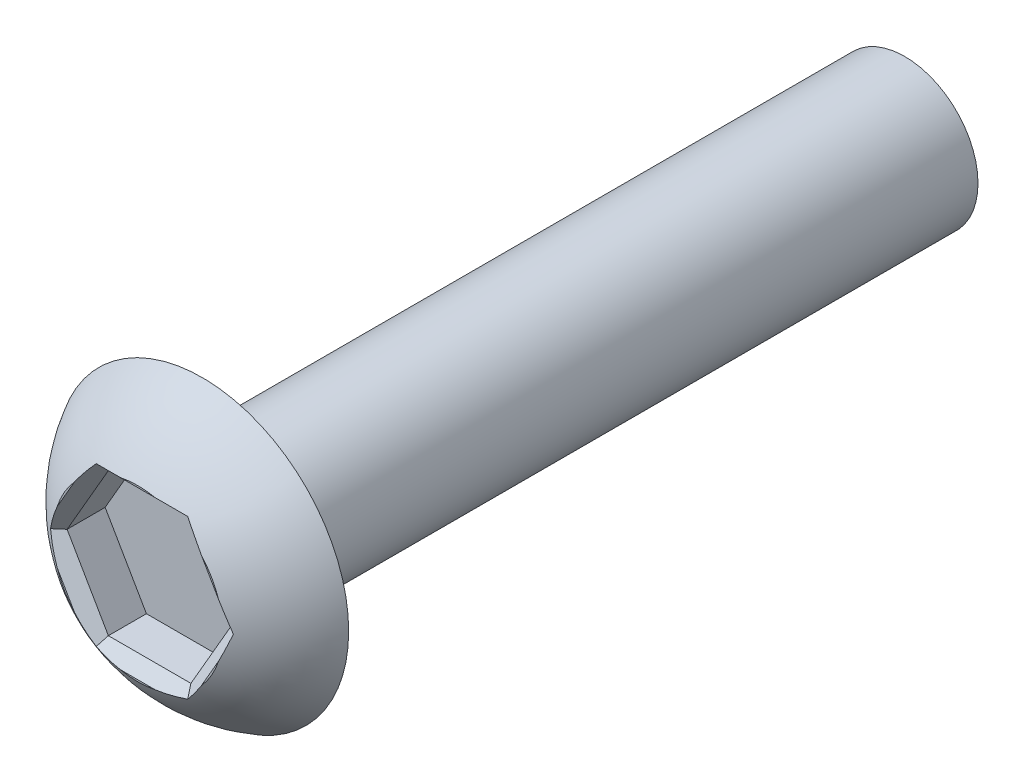
from build123d import *

# Parameters (mm, degrees)
SKETCH1_R               = 1.25
BOSS_EXTRUDE1_DEPTH     = 12
CUT_EXTRUDE1_DEPTH      = 1.25
CUT_EXTRUDE2_DEPTH      = 13.509996003
CUT_EXTRUDE2_DEPTH_BACK = 13.509996003
SKETCH6_W               = 1.249656436
SKETCH6_H               = 4.384153796
CHAMFER2_SIZE           = 0.2


with BuildPart() as part:
    # Sketch1 → Boss-Extrude1 (new body)
    with BuildSketch(Plane.XY):
        Circle(SKETCH1_R)
    extrude(amount=-BOSS_EXTRUDE1_DEPTH)

    # Sketch3 → Revolve1 (revolve)
    with BuildSketch(Plane(origin=(0, 0, 0), x_dir=(0, 0, -1), z_dir=(1, 0, 0)), mode=Mode.PRIVATE) as revolve1_sk:
        with BuildLine():
            ThreePointArc((-1.5, 0), (-1.096229956, 1.457737974), (0, 2.5))
            Line((0, 2.5), (0, 0))
            Line((0, 0), (-1.5, 0))
        make_face()
    revolve(revolve1_sk.sketch.rotate(Axis((0, 0, 1.5), (0, 0, -1)), 180), axis=Axis((0, 0, 1.5), (0, 0, -1)))

    # Sketch5 → Cut-Extrude1 (cut)
    with BuildSketch(Plane(origin=(0, 0, 1.5), x_dir=(-1, 0, 0), z_dir=(0, 0, -1))):
        Polygon((-1.409901945, 0), (-0.704950973, -1.221010901), (0.704950973, -1.221010901), (1.409901945, 0), (0.704950973, 1.221010901), (-0.704950973, 1.221010901), align=None)
    extrude(amount=CUT_EXTRUDE1_DEPTH, mode=Mode.SUBTRACT)

    # Sketch6 → Cut-Extrude2 (cut, two sides: drawn at the far end of the back side and taken through both)
    with BuildSketch(Plane(origin=(0, 0, 0), x_dir=(0, 0, -1), z_dir=(1, 0, 0)).offset(-CUT_EXTRUDE2_DEPTH_BACK)):
        with Locations((-1.724828218, 0.205450463)):
            Rectangle(SKETCH6_W, SKETCH6_H)
    extrude(amount=CUT_EXTRUDE2_DEPTH + CUT_EXTRUDE2_DEPTH_BACK, mode=Mode.SUBTRACT)

    # Chamfer2
    # the kernel refuses this chamfer: 0.2 mm, written as the material it takes off along each edge
    with BuildSketch(Plane(origin=(1.21928757, 1.221010901, 1.1), x_dir=(1.0390370186618431e-14, 0.9996219169112966, 0.02749587661058733), z_dir=(-1, 0, 0))) as chamfer2_piece_1_section:
        Polygon((CHAMFER2_SIZE * 0.999621916911, CHAMFER2_SIZE * 0.0274958766106), (-CHAMFER2_SIZE * 0.0274958766106, CHAMFER2_SIZE * 0.999621916911), (0, 0), align=None)
    chamfer2_piece_1 = extrude(amount=2.43857514, mode=Mode.PRIVATE)
    chamfer2_piece_1 = split(chamfer2_piece_1, bisect_by=Plane(origin=(0.501104512, 1.574083329, 1.032865614), z_dir=(-0.8660254037844416, -0.49999999999999495, 0)), keep=Keep.TOP, mode=Mode.PRIVATE)
    chamfer2_piece_1 = split(chamfer2_piece_1, bisect_by=Plane(origin=(-0.501104512, 1.574083329, 1.032865614), z_dir=(0.8660254037844347, -0.500000000000007, 0)), keep=Keep.TOP, mode=Mode.PRIVATE)
    add(chamfer2_piece_1, mode=Mode.SUBTRACT)
    with BuildSketch(Plane(origin=(1.667070244, -0.44542856, 1.1), x_dir=(0.8656979742248833, 0.4998109584556433, 0.027495876610586282), z_dir=(-0.49999999999999495, 0.8660254037844416, 0))) as chamfer2_piece_2_section:
        Polygon((CHAMFER2_SIZE * 0.999621916911, CHAMFER2_SIZE * 0.0274958766106), (-CHAMFER2_SIZE * 0.0274958766106, CHAMFER2_SIZE * 0.999621916911), (0, 0), align=None)
    chamfer2_piece_2 = extrude(amount=2.43857514, mode=Mode.PRIVATE)
    chamfer2_piece_2 = split(chamfer2_piece_2, bisect_by=Plane(origin=(1.613748406, 0.353072427, 1.032865614), z_dir=(-0.8660254037844382, 0.500000000000001, 0)), keep=Keep.TOP, mode=Mode.PRIVATE)
    chamfer2_piece_2 = split(chamfer2_piece_2, bisect_by=Plane(origin=(1.112643894, 1.221010901, 1.032865614), z_dir=(0, -1, 0)), keep=Keep.TOP, mode=Mode.PRIVATE)
    add(chamfer2_piece_2, mode=Mode.SUBTRACT)
    with BuildSketch(Plane(origin=(0.447782674, -1.666439461, 1.1), x_dir=(0.8656979742248797, -0.4998109584556493, 0.02749587661058626), z_dir=(0.500000000000001, 0.8660254037844382, 0))) as chamfer2_piece_3_section:
        Polygon((CHAMFER2_SIZE * 0.999621916911, CHAMFER2_SIZE * 0.0274958766106), (-CHAMFER2_SIZE * 0.0274958766106, CHAMFER2_SIZE * 0.999621916911), (0, 0), align=None)
    chamfer2_piece_3 = extrude(amount=2.43857514, mode=Mode.PRIVATE)
    chamfer2_piece_3 = split(chamfer2_piece_3, bisect_by=Plane(origin=(1.112643894, -1.221010901, 1.032865614), z_dir=(0, 1, 0)), keep=Keep.TOP, mode=Mode.PRIVATE)
    chamfer2_piece_3 = split(chamfer2_piece_3, bisect_by=Plane(origin=(1.613748406, -0.353072427, 1.032865614), z_dir=(-0.8660254037844416, -0.49999999999999495, 0)), keep=Keep.TOP, mode=Mode.PRIVATE)
    add(chamfer2_piece_3, mode=Mode.SUBTRACT)
    with BuildSketch(Plane(origin=(-1.21928757, -1.221010901, 1.1), x_dir=(-3.30602687756041e-15, -0.9996219169112968, 0.027495876610586285), z_dir=(1, 0, 0))) as chamfer2_piece_4_section:
        Polygon((CHAMFER2_SIZE * 0.999621916911, CHAMFER2_SIZE * 0.0274958766106), (-CHAMFER2_SIZE * 0.0274958766106, CHAMFER2_SIZE * 0.999621916911), (0, 0), align=None)
    chamfer2_piece_4 = extrude(amount=2.43857514, mode=Mode.PRIVATE)
    chamfer2_piece_4 = split(chamfer2_piece_4, bisect_by=Plane(origin=(-0.501104512, -1.574083329, 1.032865614), z_dir=(0.8660254037844417, 0.49999999999999484, 0)), keep=Keep.TOP, mode=Mode.PRIVATE)
    chamfer2_piece_4 = split(chamfer2_piece_4, bisect_by=Plane(origin=(0.501104512, -1.574083329, 1.032865614), z_dir=(-0.8660254037844382, 0.500000000000001, 0)), keep=Keep.TOP, mode=Mode.PRIVATE)
    add(chamfer2_piece_4, mode=Mode.SUBTRACT)
    with BuildSketch(Plane(origin=(-1.667070244, 0.44542856, 1.1), x_dir=(-0.8656979742248834, -0.4998109584556432, 0.027495876610586265), z_dir=(0.49999999999999484, -0.8660254037844417, 0))) as chamfer2_piece_5_section:
        Polygon((CHAMFER2_SIZE * 0.999621916911, CHAMFER2_SIZE * 0.0274958766106), (-CHAMFER2_SIZE * 0.0274958766106, CHAMFER2_SIZE * 0.999621916911), (0, 0), align=None)
    chamfer2_piece_5 = extrude(amount=2.43857514, mode=Mode.PRIVATE)
    chamfer2_piece_5 = split(chamfer2_piece_5, bisect_by=Plane(origin=(-1.112643894, -1.221010901, 1.032865614), z_dir=(0, 1, 0)), keep=Keep.TOP, mode=Mode.PRIVATE)
    chamfer2_piece_5 = split(chamfer2_piece_5, bisect_by=Plane(origin=(-1.613748406, -0.353072427, 1.032865614), z_dir=(0.8660254037844347, -0.500000000000007, 0)), keep=Keep.TOP, mode=Mode.PRIVATE)
    add(chamfer2_piece_5, mode=Mode.SUBTRACT)
    with BuildSketch(Plane(origin=(-0.447782674, 1.666439461, 1.1), x_dir=(-0.8656979742248764, 0.4998109584556554, 0.027495876610586265), z_dir=(-0.500000000000007, -0.8660254037844347, 0))) as chamfer2_piece_6_section:
        Polygon((CHAMFER2_SIZE * 0.999621916911, CHAMFER2_SIZE * 0.0274958766106), (-CHAMFER2_SIZE * 0.0274958766106, CHAMFER2_SIZE * 0.999621916911), (0, 0), align=None)
    chamfer2_piece_6 = extrude(amount=2.43857514, mode=Mode.PRIVATE)
    chamfer2_piece_6 = split(chamfer2_piece_6, bisect_by=Plane(origin=(-1.112643894, 1.221010901, 1.032865614), z_dir=(0, -1, 0)), keep=Keep.TOP, mode=Mode.PRIVATE)
    chamfer2_piece_6 = split(chamfer2_piece_6, bisect_by=Plane(origin=(-1.613748406, 0.353072427, 1.032865614), z_dir=(0.8660254037844417, 0.49999999999999484, 0)), keep=Keep.TOP, mode=Mode.PRIVATE)
    add(chamfer2_piece_6, mode=Mode.SUBTRACT)
    with BuildSketch(Plane(origin=(1.667070244, -0.44542856, 1.1), x_dir=(0.8656979742248833, 0.4998109584556433, 0.027495876610586282), z_dir=(-0.49999999999999495, 0.8660254037844416, 0))) as chamfer2_piece_7a_section:
        Polygon((CHAMFER2_SIZE * 0.999621916911, CHAMFER2_SIZE * 0.0274958766106), (-CHAMFER2_SIZE * 0.0274958766106, CHAMFER2_SIZE * 0.999621916911), (0, 0), align=None)
    chamfer2_piece_7a = extrude(amount=2.43857514, mode=Mode.PRIVATE)
    chamfer2_piece_7a = split(chamfer2_piece_7a, bisect_by=Plane(origin=(0.645691333, 1.221010901, 1.035460513), z_dir=(0, 1, 0)), keep=Keep.TOP, mode=Mode.PRIVATE)
    with BuildSketch(Plane(origin=(1.21928757, 1.221010901, 1.1), x_dir=(1.0390370186618431e-14, 0.9996219169112966, 0.02749587661058733), z_dir=(-1, 0, 0))) as chamfer2_piece_7b_section:
        Polygon((CHAMFER2_SIZE * 0.999621916911, CHAMFER2_SIZE * 0.0274958766106), (-CHAMFER2_SIZE * 0.0274958766106, CHAMFER2_SIZE * 0.999621916911), (0, 0), align=None)
    chamfer2_piece_7b = extrude(amount=2.43857514, mode=Mode.PRIVATE)
    chamfer2_piece_7b = split(chamfer2_piece_7b, bisect_by=Plane(origin=(0.734580793, 1.169690548, 1.035460513), z_dir=(0.8660254037844416, 0.49999999999999495, 0)), keep=Keep.TOP, mode=Mode.PRIVATE)
    chamfer2_piece_7 = chamfer2_piece_7a & chamfer2_piece_7b
    add(chamfer2_piece_7, mode=Mode.SUBTRACT)
    with BuildSketch(Plane(origin=(1.21928757, 1.221010901, 1.1), x_dir=(1.0390370186618431e-14, 0.9996219169112966, 0.02749587661058733), z_dir=(-1, 0, 0))) as chamfer2_piece_8a_section:
        Polygon((CHAMFER2_SIZE * 0.999621916911, CHAMFER2_SIZE * 0.0274958766106), (-CHAMFER2_SIZE * 0.0274958766106, CHAMFER2_SIZE * 0.999621916911), (0, 0), align=None)
    chamfer2_piece_8a = extrude(amount=2.43857514, mode=Mode.PRIVATE)
    chamfer2_piece_8a = split(chamfer2_piece_8a, bisect_by=Plane(origin=(-0.734580793, 1.169690548, 1.035460513), z_dir=(-0.8660254037844347, 0.500000000000007, 0)), keep=Keep.TOP, mode=Mode.PRIVATE)
    with BuildSketch(Plane(origin=(-0.447782674, 1.666439461, 1.1), x_dir=(-0.8656979742248764, 0.4998109584556554, 0.027495876610586265), z_dir=(-0.500000000000007, -0.8660254037844347, 0))) as chamfer2_piece_8b_section:
        Polygon((CHAMFER2_SIZE * 0.999621916911, CHAMFER2_SIZE * 0.0274958766106), (-CHAMFER2_SIZE * 0.0274958766106, CHAMFER2_SIZE * 0.999621916911), (0, 0), align=None)
    chamfer2_piece_8b = extrude(amount=2.43857514, mode=Mode.PRIVATE)
    chamfer2_piece_8b = split(chamfer2_piece_8b, bisect_by=Plane(origin=(-0.645691333, 1.221010901, 1.035460513), z_dir=(0, 1, 0)), keep=Keep.TOP, mode=Mode.PRIVATE)
    chamfer2_piece_8 = chamfer2_piece_8a & chamfer2_piece_8b
    add(chamfer2_piece_8, mode=Mode.SUBTRACT)
    with BuildSketch(Plane(origin=(0.447782674, -1.666439461, 1.1), x_dir=(0.8656979742248797, -0.4998109584556493, 0.02749587661058626), z_dir=(0.500000000000001, 0.8660254037844382, 0))) as chamfer2_piece_9a_section:
        Polygon((CHAMFER2_SIZE * 0.999621916911, CHAMFER2_SIZE * 0.0274958766106), (-CHAMFER2_SIZE * 0.0274958766106, CHAMFER2_SIZE * 0.999621916911), (0, 0), align=None)
    chamfer2_piece_9a = extrude(amount=2.43857514, mode=Mode.PRIVATE)
    chamfer2_piece_9a = split(chamfer2_piece_9a, bisect_by=Plane(origin=(1.380272125, 0.051320354, 1.035460513), z_dir=(0.8660254037844416, 0.49999999999999495, 0)), keep=Keep.TOP, mode=Mode.PRIVATE)
    with BuildSketch(Plane(origin=(1.667070244, -0.44542856, 1.1), x_dir=(0.8656979742248833, 0.4998109584556433, 0.027495876610586282), z_dir=(-0.49999999999999495, 0.8660254037844416, 0))) as chamfer2_piece_9b_section:
        Polygon((CHAMFER2_SIZE * 0.999621916911, CHAMFER2_SIZE * 0.0274958766106), (-CHAMFER2_SIZE * 0.0274958766106, CHAMFER2_SIZE * 0.999621916911), (0, 0), align=None)
    chamfer2_piece_9b = extrude(amount=2.43857514, mode=Mode.PRIVATE)
    chamfer2_piece_9b = split(chamfer2_piece_9b, bisect_by=Plane(origin=(1.380272125, -0.051320354, 1.035460513), z_dir=(0.8660254037844382, -0.500000000000001, 0)), keep=Keep.TOP, mode=Mode.PRIVATE)
    chamfer2_piece_9 = chamfer2_piece_9a & chamfer2_piece_9b
    add(chamfer2_piece_9, mode=Mode.SUBTRACT)
    with BuildSketch(Plane(origin=(-1.21928757, -1.221010901, 1.1), x_dir=(-3.30602687756041e-15, -0.9996219169112968, 0.027495876610586285), z_dir=(1, 0, 0))) as chamfer2_piece_10a_section:
        Polygon((CHAMFER2_SIZE * 0.999621916911, CHAMFER2_SIZE * 0.0274958766106), (-CHAMFER2_SIZE * 0.0274958766106, CHAMFER2_SIZE * 0.999621916911), (0, 0), align=None)
    chamfer2_piece_10a = extrude(amount=2.43857514, mode=Mode.PRIVATE)
    chamfer2_piece_10a = split(chamfer2_piece_10a, bisect_by=Plane(origin=(0.734580793, -1.169690548, 1.035460513), z_dir=(0.8660254037844382, -0.500000000000001, 0)), keep=Keep.TOP, mode=Mode.PRIVATE)
    with BuildSketch(Plane(origin=(0.447782674, -1.666439461, 1.1), x_dir=(0.8656979742248797, -0.4998109584556493, 0.02749587661058626), z_dir=(0.500000000000001, 0.8660254037844382, 0))) as chamfer2_piece_10b_section:
        Polygon((CHAMFER2_SIZE * 0.999621916911, CHAMFER2_SIZE * 0.0274958766106), (-CHAMFER2_SIZE * 0.0274958766106, CHAMFER2_SIZE * 0.999621916911), (0, 0), align=None)
    chamfer2_piece_10b = extrude(amount=2.43857514, mode=Mode.PRIVATE)
    chamfer2_piece_10b = split(chamfer2_piece_10b, bisect_by=Plane(origin=(0.645691333, -1.221010901, 1.035460513), z_dir=(0, -1, 0)), keep=Keep.TOP, mode=Mode.PRIVATE)
    chamfer2_piece_10 = chamfer2_piece_10a & chamfer2_piece_10b
    add(chamfer2_piece_10, mode=Mode.SUBTRACT)
    with BuildSketch(Plane(origin=(-1.21928757, -1.221010901, 1.1), x_dir=(-3.30602687756041e-15, -0.9996219169112968, 0.027495876610586285), z_dir=(1, 0, 0))) as chamfer2_piece_11a_section:
        Polygon((CHAMFER2_SIZE * 0.999621916911, CHAMFER2_SIZE * 0.0274958766106), (-CHAMFER2_SIZE * 0.0274958766106, CHAMFER2_SIZE * 0.999621916911), (0, 0), align=None)
    chamfer2_piece_11a = extrude(amount=2.43857514, mode=Mode.PRIVATE)
    chamfer2_piece_11a = split(chamfer2_piece_11a, bisect_by=Plane(origin=(-0.734580793, -1.169690548, 1.035460513), z_dir=(-0.8660254037844417, -0.49999999999999484, 0)), keep=Keep.TOP, mode=Mode.PRIVATE)
    with BuildSketch(Plane(origin=(-1.667070244, 0.44542856, 1.1), x_dir=(-0.8656979742248834, -0.4998109584556432, 0.027495876610586265), z_dir=(0.49999999999999484, -0.8660254037844417, 0))) as chamfer2_piece_11b_section:
        Polygon((CHAMFER2_SIZE * 0.999621916911, CHAMFER2_SIZE * 0.0274958766106), (-CHAMFER2_SIZE * 0.0274958766106, CHAMFER2_SIZE * 0.999621916911), (0, 0), align=None)
    chamfer2_piece_11b = extrude(amount=2.43857514, mode=Mode.PRIVATE)
    chamfer2_piece_11b = split(chamfer2_piece_11b, bisect_by=Plane(origin=(-0.645691333, -1.221010901, 1.035460513), z_dir=(0, -1, 0)), keep=Keep.TOP, mode=Mode.PRIVATE)
    chamfer2_piece_11 = chamfer2_piece_11a & chamfer2_piece_11b
    add(chamfer2_piece_11, mode=Mode.SUBTRACT)
    with BuildSketch(Plane(origin=(-0.447782674, 1.666439461, 1.1), x_dir=(-0.8656979742248764, 0.4998109584556554, 0.027495876610586265), z_dir=(-0.500000000000007, -0.8660254037844347, 0))) as chamfer2_piece_12a_section:
        Polygon((CHAMFER2_SIZE * 0.999621916911, CHAMFER2_SIZE * 0.0274958766106), (-CHAMFER2_SIZE * 0.0274958766106, CHAMFER2_SIZE * 0.999621916911), (0, 0), align=None)
    chamfer2_piece_12a = extrude(amount=2.43857514, mode=Mode.PRIVATE)
    chamfer2_piece_12a = split(chamfer2_piece_12a, bisect_by=Plane(origin=(-1.380272125, -0.051320354, 1.035460513), z_dir=(-0.8660254037844417, -0.49999999999999484, 0)), keep=Keep.TOP, mode=Mode.PRIVATE)
    with BuildSketch(Plane(origin=(-1.667070244, 0.44542856, 1.1), x_dir=(-0.8656979742248834, -0.4998109584556432, 0.027495876610586265), z_dir=(0.49999999999999484, -0.8660254037844417, 0))) as chamfer2_piece_12b_section:
        Polygon((CHAMFER2_SIZE * 0.999621916911, CHAMFER2_SIZE * 0.0274958766106), (-CHAMFER2_SIZE * 0.0274958766106, CHAMFER2_SIZE * 0.999621916911), (0, 0), align=None)
    chamfer2_piece_12b = extrude(amount=2.43857514, mode=Mode.PRIVATE)
    chamfer2_piece_12b = split(chamfer2_piece_12b, bisect_by=Plane(origin=(-1.380272125, 0.051320354, 1.035460513), z_dir=(-0.8660254037844347, 0.500000000000007, 0)), keep=Keep.TOP, mode=Mode.PRIVATE)
    chamfer2_piece_12 = chamfer2_piece_12a & chamfer2_piece_12b
    add(chamfer2_piece_12, mode=Mode.SUBTRACT)


solid = part.part
